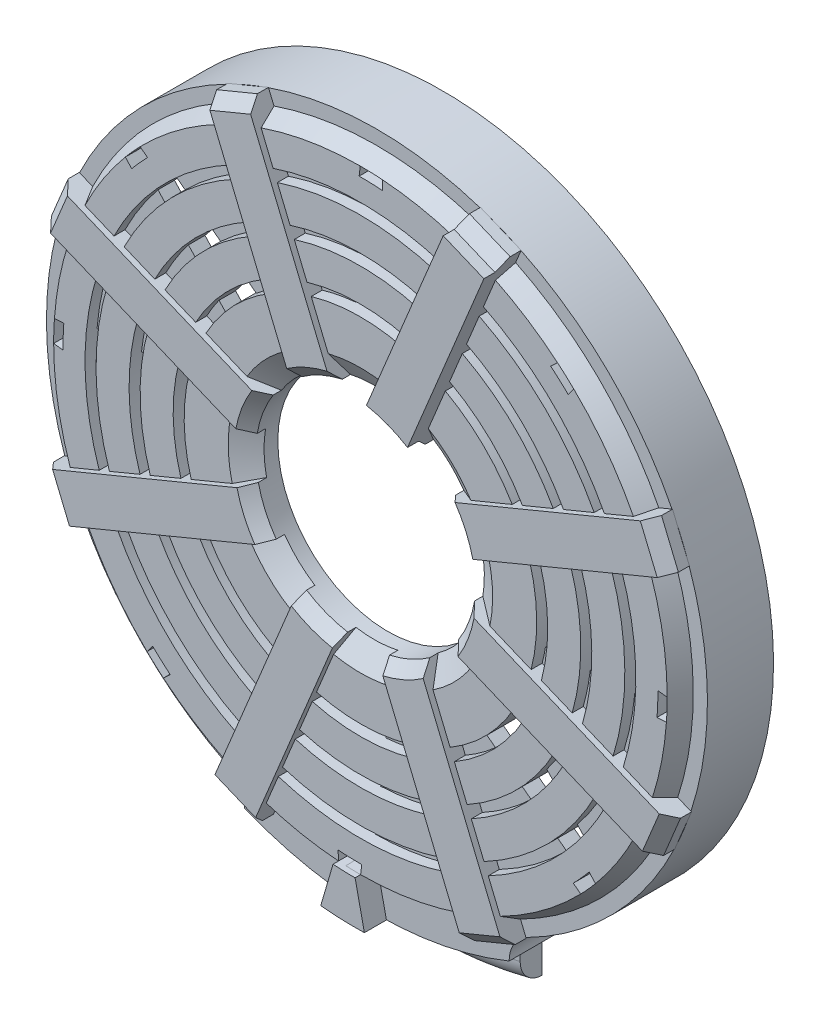
from build123d import *
from build123d.topology import SkipClean

# Parameters (mm, degrees)
SKETCH_2_R           = 26.935647111
EXTRUDE_1_DEPTH      = 2
CUT_EXTRUDE_START    = -2
CUT_EXTRUDE_3_DEPTH  = 2
CUT_EXTRUDE_4_DEPTH  = 2
FILLET_2_R           = 2
EXTRUDE_START        = -2
EXTRUDE_2_DEPTH      = 2
EXTRUDE_3_DEPTH      = 4
SKETCH_9_R           = 30
SKETCH_9_R_2         = 27
EXTRUDE_5_DEPTH      = 4
SKETCH_10_R          = 29
EXTRUDE_6_DEPTH      = 1.5
CHAMFER_1_SIZE       = 2
CHAMFER_1_SIZE_2     = 1.154700538
SKETCH_12_R          = 10
CUT_EXTRUDE_5_DEPTH  = 18
SKETCH_13_R          = 27
EXTRUDE_7_DEPTH      = 6
SKETCH_14_R          = 10
CUT_EXTRUDE_6_DEPTH  = 8
SKETCH_16_R          = 27
CUT_EXTRUDE_7_DEPTH  = 5
CHAMFER_2_SIZE       = 2
CHAMFER_2_SIZE2      = 1.249738704
SKETCH_17_R          = 25
SKETCH_17_R_2        = 24
SKETCH_17_R_3        = 21
SKETCH_17_R_4        = 20
SKETCH_17_R_5        = 17
SKETCH_17_R_6        = 16
CUT_EXTRUDE_10_DEPTH = 1
SKETCH_18_W          = 3
SKETCH_18_H          = 1
CUT_EXTRUDE_11_DEPTH = 71
SKETCH_25_R          = 10.8
SKETCH_25_R_2        = 10.020616019
EXTRUDE_18_DEPTH     = 1
EXTRUDE_19_DEPTH     = 1.5
CHAMFER_3_SIZE       = 2
CHAMFER_4_SIZE       = 2
CUT_EXTRUDE_13_DEPTH = 10
CUT_EXTRUDE_14_DEPTH = 10
EXTRUDE_20_DEPTH     = 3
SKETCH_34_R          = 44.888176971
CUT_EXTRUDE_15_DEPTH = 1
EXTRUDE_21_DEPTH     = 1


# Some blends are built 0.0001 mm under size
with BuildPart() as part:
    # 草图2 → 凸台-拉伸1 (new body)
    with BuildSketch(Plane.XY.offset(20)):
        with BuildLine():
            Line((12, -35.49545417), (12, -29.393876913))
            ThreePointArc((12, -29.393876913), (12.441591404, -27.82717801), (13.636363636, -26.721706285))
            ThreePointArc((13.636363636, -26.721706285), (0, 30), (-13.636363636, -26.721706285))
            ThreePointArc((-13.636363636, -26.721706285), (-12.441591404, -27.82717801), (-12, -29.393876913))
            Line((-12, -29.393876913), (-12, -35.49545417))
            ThreePointArc((-12, -35.49545417), (0, -37.469017424), (12, -35.49545417))
        make_face()
        Circle(SKETCH_2_R, mode=Mode.SUBTRACT)
    extrude(amount=EXTRUDE_1_DEPTH)

    # 草图3 → 切除-拉伸3 (cut)
    with BuildSketch(Plane.XY.offset(22).offset(CUT_EXTRUDE_START)):
        with BuildLine():
            Line((-9, -36.372067122), (-9, -28.618176043))
            ThreePointArc((-9, -28.618176043), (-11.357833819, -27.766879748), (-13.636363636, -26.721706285))
            ThreePointArc((-13.636363636, -26.721706285), (-12.441591404, -27.82717801), (-12, -29.393876913))
            Line((-12, -29.393876913), (-12, -35.49545417))
            ThreePointArc((-12, -35.49545417), (-10.509144236, -35.965054625), (-9, -36.372067122))
        make_face()
        with BuildLine():
            Line((9, -36.372067122), (9, -28.618176043))
            ThreePointArc((9, -28.618176043), (11.357833819, -27.766879748), (13.636363636, -26.721706285))
            ThreePointArc((13.636363636, -26.721706285), (12.441591404, -27.82717801), (12, -29.393876913))
            Line((12, -29.393876913), (12, -35.49545417))
            ThreePointArc((12, -35.49545417), (10.509144236, -35.965054625), (9, -36.372067122))
        make_face()
    extrude(amount=CUT_EXTRUDE_3_DEPTH, mode=Mode.SUBTRACT)

    # 草图4 → 切除-拉伸4 (cut)
    with BuildSketch(Plane.XY.offset(22).offset(CUT_EXTRUDE_START)):
        with BuildLine():
            Line((9, -35), (9, -36.372067122))
            ThreePointArc((9, -36.372067122), (0, -37.469017424), (-9, -36.372067122))
            Line((-9, -36.372067122), (-9, -35))
            ThreePointArc((-9, -35), (0, -36.138621999), (9, -35))
        make_face()
    extrude(amount=CUT_EXTRUDE_4_DEPTH, mode=Mode.SUBTRACT)

    # 圆角2
    fillet_2_edges = [part.edges().sort_by_distance(p)[0] for p in [
        (0, -36.138621999, 22),
    ]]
    fillet(fillet_2_edges, radius=FILLET_2_R - 0.0001)  # a hair under: the kernel refuses the full size

    # 草图7 → 凸台-拉伸2 (add)
    with BuildSketch(Plane.XY.offset(22).offset(EXTRUDE_START)):
        with BuildLine():
            Line((-9, -30.446674695), (-9, -28.618176043))
            ThreePointArc((-9, -28.618176043), (-11.357833819, -27.766879748), (-13.636363636, -26.721706285))
            ThreePointArc((-13.636363636, -26.721706285), (-12.441591404, -27.82717801), (-12, -29.393876913))
            ThreePointArc((-12, -29.393876913), (-10.513186757, -29.957852129), (-9, -30.446674695))
        make_face()
        with BuildLine():
            ThreePointArc((9, -28.618176043), (0, -30), (-9, -28.618176043))
            Line((-9, -28.618176043), (-9, -30.446674695))
            ThreePointArc((-9, -30.446674695), (0, -31.749015733), (9, -30.446674695))
            Line((9, -30.446674695), (9, -28.618176043))
        make_face()
        with BuildLine():
            ThreePointArc((13.636363636, -26.721706285), (11.357833819, -27.766879748), (9, -28.618176043))
            Line((9, -28.618176043), (9, -30.446674695))
            ThreePointArc((9, -30.446674695), (10.513186757, -29.957852129), (12, -29.393876913))
            ThreePointArc((12, -29.393876913), (12.441591404, -27.82717801), (13.636363636, -26.721706285))
        make_face()
    extrude(amount=EXTRUDE_2_DEPTH)

    # 草图8 → 凸台-拉伸3 (add)
    with BuildSketch(Plane.XY.offset(22)):
        with BuildLine():
            ThreePointArc((-12, -29.393876913), (0, -31.749015733), (12, -29.393876913))
            ThreePointArc((12, -29.393876913), (12.441591404, -27.82717801), (13.636363636, -26.721706285))
            ThreePointArc((13.636363636, -26.721706285), (0, -30), (-13.636363636, -26.721706285))
            ThreePointArc((-13.636363636, -26.721706285), (-12.441591404, -27.82717801), (-12, -29.393876913))
        make_face()
    extrude(amount=EXTRUDE_3_DEPTH)

    # 草图9 → 凸台-拉伸5 (add)
    with BuildSketch(Plane.XY.offset(22)):
        Circle(SKETCH_9_R)
        Circle(SKETCH_9_R_2, mode=Mode.SUBTRACT)
    extrude(amount=EXTRUDE_5_DEPTH)

    # 草图10 → 凸台-拉伸6 (add)
    with BuildSketch(Plane.XY.offset(26)):
        with Locations(Location((0, 0, 0), (0, 0, 180))):
            Circle(SKETCH_10_R)
    extrude(amount=EXTRUDE_6_DEPTH)

    # 倒角1
    # the kernel refuses this chamfer: 2, 1.154700538 mm, written as the material it takes off along each edge
    with BuildSketch(Plane(origin=(0, 0, 27.5), x_dir=(-1, 0, 0), z_dir=(0, 1, 0))) as chamfer_1_piece_1_section:
        Polygon((29, -CHAMFER_1_SIZE), (29 - CHAMFER_1_SIZE_2, 0), (29, 0), align=None)
    chamfer_1_piece_1 = revolve(axis=Axis((0, 0, 27.5), (0, 0, 1)), mode=Mode.PRIVATE)
    chamfer_1_piece_1 = split(chamfer_1_piece_1, bisect_by=Plane(origin=(28.310285577, 0, 26), z_dir=(0, 0, 1)), keep=Keep.TOP, mode=Mode.PRIVATE)
    add(chamfer_1_piece_1, mode=Mode.SUBTRACT)

    # 草图12 → 切除-拉伸5 (cut)
    with BuildSketch(Plane.XY.offset(27.5)):
        Circle(SKETCH_12_R)
    extrude(amount=-CUT_EXTRUDE_5_DEPTH, mode=Mode.SUBTRACT)

    # 草图13 → 凸台-拉伸7 (add)
    with BuildSketch(Plane(origin=(0, 0, 20), x_dir=(-1, 0, 0), z_dir=(0, 0, -1))):
        Circle(SKETCH_13_R)
    extrude(amount=-EXTRUDE_7_DEPTH)

    # 草图14 → 切除-拉伸6 (cut)
    with BuildSketch(Plane.XY.offset(27.5)):
        Circle(SKETCH_14_R)
    extrude(amount=-CUT_EXTRUDE_6_DEPTH, mode=Mode.SUBTRACT)

    # 草图16 → 切除-拉伸7 (cut)
    with BuildSketch(Plane(origin=(0, 0, 20), x_dir=(-1, 0, 0), z_dir=(0, 0, -1))):
        Circle(SKETCH_16_R)
    extrude(amount=-CUT_EXTRUDE_7_DEPTH, mode=Mode.SUBTRACT)

    # 倒角2
    chamfer_2_edges = [part.edges().sort_by_distance(p)[0] for p in [
        (-10, 0, 27.5),
    ]]
    chamfer_2_side = [part.faces().sort_by_distance(p)[0] for p in [
        (27.057715459, 0, 27.5),
    ]]
    chamfer(chamfer_2_edges, length=CHAMFER_2_SIZE, length2=CHAMFER_2_SIZE2, reference=chamfer_2_side[0])

    # 草图17 → 切除-拉伸10 (cut)
    # profile 1 of 3: a face of its own
    with BuildSketch(Plane.XY.offset(27.5)):
        Circle(SKETCH_17_R)
        Circle(SKETCH_17_R_2, mode=Mode.SUBTRACT)
    # profile 2 of 3: a face of its own
    with BuildSketch(Plane.XY.offset(27.5)):
        Circle(SKETCH_17_R_3)
        Circle(SKETCH_17_R_4, mode=Mode.SUBTRACT)
    # profile 3 of 3: a face of its own
    with BuildSketch(Plane.XY.offset(27.5)):
        Circle(SKETCH_17_R_5)
        Circle(SKETCH_17_R_6, mode=Mode.SUBTRACT)
    extrude(amount=-CUT_EXTRUDE_10_DEPTH, mode=Mode.SUBTRACT)

    # 草图18 → 切除-拉伸11 (cut)
    with BuildSketch(Plane(origin=(0, 0, 0), x_dir=(1, 0, 0), z_dir=(0, 1, 0))):
        with Locations((-9, -23.265514754)):
            Rectangle(SKETCH_18_W, SKETCH_18_H)
        with Locations((-3, -23.265514754)):
            Rectangle(SKETCH_18_W, SKETCH_18_H)
        with Locations((9, -23.265514754)):
            Rectangle(SKETCH_18_W, SKETCH_18_H)
        with Locations((3, -23.265514754)):
            Rectangle(SKETCH_18_W, SKETCH_18_H)
    extrude(amount=-CUT_EXTRUDE_11_DEPTH, mode=Mode.SUBTRACT)

    # 草图25 → 凸台-拉伸18 (add)
    with BuildSketch(Plane(origin=(0, 0, 25), x_dir=(-1, 0, 0), z_dir=(0, 0, -1))):
        Circle(SKETCH_25_R)
        Circle(SKETCH_25_R_2, mode=Mode.SUBTRACT)
    extrude(amount=-EXTRUDE_18_DEPTH)

    # 草图26 → 凸台-拉伸19 (add, symmetric)
    with SkipClean():  # the faces are left unmerged after this step: merging them gives an invalid solid
        with BuildSketch(Plane.XY.offset(27.5)):
            with BuildLine():
                ThreePointArc((-12.696537001, 24.782224482), (-10.883678655, 25.630182228), (-9.014595586, 26.345735301))
                Line((-9.014595586, 26.345735301), (-9.849943097, 28.362442592))
                Line((-9.849943097, 28.362442592), (-13.545461227, 26.831708862))
                Line((-13.545461227, 26.831708862), (-12.696537001, 24.782224482))
            make_face()
            with BuildLine():
                ThreePointArc((-5.804366846, 8.14305382), (-4.057894195, 9.139666006), (-2.147344545, 9.766724702))
                Line((-2.147344545, 9.766724702), (-7.923333429, 23.711195402))
                ThreePointArc((-7.923333429, 23.711195402), (-9.794923887, 23.001292704), (-11.603720064, 22.143931012))
                Line((-11.603720064, 22.143931012), (-5.804366846, 8.14305382))
            make_face()
            with BuildLine():
                ThreePointArc((-11.603720064, 22.143931012), (-9.794923887, 23.001292704), (-7.923333429, 23.711195402))
                Line((-7.923333429, 23.711195402), (-9.014595586, 26.345735301))
                ThreePointArc((-9.014595586, 26.345735301), (-10.883678655, 25.630182228), (-12.696537001, 24.782224482))
                Line((-12.696537001, 24.782224482), (-11.603720064, 22.143931012))
            make_face()
            with BuildLine():
                ThreePointArc((8.545871573, 26.501486395), (10.427352675, 25.819198638), (12.254966418, 25.003529755))
                Line((12.254966418, 25.003529755), (13.090313929, 27.020237046))
                Line((13.090313929, 27.020237046), (9.394795799, 28.550970775))
                Line((9.394795799, 28.550970775), (8.545871573, 26.501486395))
            make_face()
            with BuildLine():
                ThreePointArc((7.453054636, 23.863192925), (9.338312945, 23.190427149), (11.163704261, 22.368989856))
                Line((11.163704261, 22.368989856), (12.254966418, 25.003529755))
                ThreePointArc((12.254966418, 25.003529755), (10.427352675, 25.819198638), (8.545871573, 26.501486395))
                Line((8.545871573, 26.501486395), (7.453054636, 23.863192925))
            make_face()
            with BuildLine():
                ThreePointArc((1.653701418, 9.862315733), (3.593355308, 9.332084313), (5.387715377, 8.424519156))
                Line((5.387715377, 8.424519156), (11.163704261, 22.368989856))
                ThreePointArc((11.163704261, 22.368989856), (9.338312945, 23.190427149), (7.453054636, 23.863192925))
                Line((7.453054636, 23.863192925), (1.653701418, 9.862315733))
            make_face()
            with BuildLine():
                Line((22.143931012, 11.603720064), (8.14305382, 5.804366846))
                ThreePointArc((8.14305382, 5.804366846), (9.139666006, 4.057894195), (9.766724702, 2.147344545))
                Line((9.766724702, 2.147344545), (23.711195402, 7.923333429))
                ThreePointArc((23.711195402, 7.923333429), (23.001292704, 9.794923887), (22.143931012, 11.603720064))
            make_face()
            with BuildLine():
                Line((24.782224482, 12.696537001), (22.143931012, 11.603720064))
                ThreePointArc((22.143931012, 11.603720064), (23.001292704, 9.794923887), (23.711195402, 7.923333429))
                Line((23.711195402, 7.923333429), (26.345735301, 9.014595586))
                ThreePointArc((26.345735301, 9.014595586), (25.630182228, 10.883678655), (24.782224482, 12.696537001))
            make_face()
            with BuildLine():
                Line((26.831708862, 13.545461227), (24.782224482, 12.696537001))
                ThreePointArc((24.782224482, 12.696537001), (25.630182228, 10.883678655), (26.345735301, 9.014595586))
                Line((26.345735301, 9.014595586), (28.362442592, 9.849943097))
                Line((28.362442592, 9.849943097), (26.831708862, 13.545461227))
            make_face()
            with BuildLine():
                Line((26.501486395, -8.545871573), (23.863192925, -7.453054636))
                ThreePointArc((23.863192925, -7.453054636), (23.190427149, -9.338312945), (22.368989856, -11.163704261))
                Line((22.368989856, -11.163704261), (25.003529755, -12.254966418))
                ThreePointArc((25.003529755, -12.254966418), (25.819198638, -10.427352675), (26.501486395, -8.545871573))
            make_face()
            with BuildLine():
                Line((28.550970775, -9.394795799), (26.501486395, -8.545871573))
                ThreePointArc((26.501486395, -8.545871573), (25.819198638, -10.427352675), (25.003529755, -12.254966418))
                Line((25.003529755, -12.254966418), (27.020237046, -13.090313929))
                Line((27.020237046, -13.090313929), (28.550970775, -9.394795799))
            make_face()
            with BuildLine():
                Line((23.863192925, -7.453054636), (9.862315733, -1.653701418))
                ThreePointArc((9.862315733, -1.653701418), (9.332084313, -3.593355308), (8.424519156, -5.387715377))
                Line((8.424519156, -5.387715377), (22.368989856, -11.163704261))
                ThreePointArc((22.368989856, -11.163704261), (23.190427149, -9.338312945), (23.863192925, -7.453054636))
            make_face()
            with BuildLine():
                Line((11.603720064, -22.143931012), (5.804366846, -8.14305382))
                ThreePointArc((5.804366846, -8.14305382), (4.057894195, -9.139666006), (2.147344545, -9.766724702))
                Line((2.147344545, -9.766724702), (7.923333429, -23.711195402))
                ThreePointArc((7.923333429, -23.711195402), (9.794923887, -23.001292704), (11.603720064, -22.143931012))
            make_face()
            with BuildLine():
                Line((12.696537001, -24.782224482), (11.603720064, -22.143931012))
                ThreePointArc((11.603720064, -22.143931012), (9.794923887, -23.001292704), (7.923333429, -23.711195402))
                Line((7.923333429, -23.711195402), (9.014595586, -26.345735301))
                ThreePointArc((9.014595586, -26.345735301), (10.883678655, -25.630182228), (12.696537001, -24.782224482))
            make_face()
            with BuildLine():
                Line((13.545461227, -26.831708862), (12.696537001, -24.782224482))
                ThreePointArc((12.696537001, -24.782224482), (10.883678655, -25.630182228), (9.014595586, -26.345735301))
                Line((9.014595586, -26.345735301), (9.849943097, -28.362442592))
                Line((9.849943097, -28.362442592), (13.545461227, -26.831708862))
            make_face()
            with BuildLine():
                Line((-9.394795799, -28.550970775), (-8.545871573, -26.501486395))
                ThreePointArc((-8.545871573, -26.501486395), (-10.427352675, -25.819198638), (-12.254966418, -25.003529755))
                Line((-12.254966418, -25.003529755), (-13.090313929, -27.020237046))
                Line((-13.090313929, -27.020237046), (-9.394795799, -28.550970775))
            make_face()
            with BuildLine():
                Line((-7.453054636, -23.863192925), (-1.653701418, -9.862315733))
                ThreePointArc((-1.653701418, -9.862315733), (-3.593355308, -9.332084313), (-5.387715377, -8.424519156))
                Line((-5.387715377, -8.424519156), (-11.163704261, -22.368989856))
                ThreePointArc((-11.163704261, -22.368989856), (-9.338312945, -23.190427149), (-7.453054636, -23.863192925))
            make_face()
            with BuildLine():
                Line((-8.545871573, -26.501486395), (-7.453054636, -23.863192925))
                ThreePointArc((-7.453054636, -23.863192925), (-9.338312945, -23.190427149), (-11.163704261, -22.368989856))
                Line((-11.163704261, -22.368989856), (-12.254966418, -25.003529755))
                ThreePointArc((-12.254966418, -25.003529755), (-10.427352675, -25.819198638), (-8.545871573, -26.501486395))
            make_face()
            with BuildLine():
                ThreePointArc((-8.14305382, -5.804366846), (-9.139666006, -4.057894195), (-9.766724702, -2.147344545))
                Line((-9.766724702, -2.147344545), (-23.711195402, -7.923333429))
                ThreePointArc((-23.711195402, -7.923333429), (-23.001292704, -9.794923887), (-22.143931012, -11.603720064))
                Line((-22.143931012, -11.603720064), (-8.14305382, -5.804366846))
            make_face()
            with BuildLine():
                ThreePointArc((-22.143931012, -11.603720064), (-23.001292704, -9.794923887), (-23.711195402, -7.923333429))
                Line((-23.711195402, -7.923333429), (-26.345735301, -9.014595586))
                ThreePointArc((-26.345735301, -9.014595586), (-25.630182228, -10.883678655), (-24.782224482, -12.696537001))
                Line((-24.782224482, -12.696537001), (-22.143931012, -11.603720064))
            make_face()
            with BuildLine():
                ThreePointArc((-24.782224482, -12.696537001), (-25.630182228, -10.883678655), (-26.345735301, -9.014595586))
                Line((-26.345735301, -9.014595586), (-28.362442592, -9.849943097))
                Line((-28.362442592, -9.849943097), (-26.831708862, -13.545461227))
                Line((-26.831708862, -13.545461227), (-24.782224482, -12.696537001))
            make_face()
            with BuildLine():
                ThreePointArc((-9.862315733, 1.653701418), (-9.332084313, 3.593355308), (-8.424519156, 5.387715377))
                Line((-8.424519156, 5.387715377), (-22.368989856, 11.163704261))
                ThreePointArc((-22.368989856, 11.163704261), (-23.190427149, 9.338312945), (-23.863192925, 7.453054636))
                Line((-23.863192925, 7.453054636), (-9.862315733, 1.653701418))
            make_face()
            with BuildLine():
                ThreePointArc((-23.863192925, 7.453054636), (-23.190427149, 9.338312945), (-22.368989856, 11.163704261))
                Line((-22.368989856, 11.163704261), (-25.003529755, 12.254966418))
                ThreePointArc((-25.003529755, 12.254966418), (-25.819198638, 10.427352675), (-26.501486395, 8.545871573))
                Line((-26.501486395, 8.545871573), (-23.863192925, 7.453054636))
            make_face()
            with BuildLine():
                ThreePointArc((-26.501486395, 8.545871573), (-25.819198638, 10.427352675), (-25.003529755, 12.254966418))
                Line((-25.003529755, 12.254966418), (-27.020237046, 13.090313929))
                Line((-27.020237046, 13.090313929), (-28.550970775, 9.394795799))
                Line((-28.550970775, 9.394795799), (-26.501486395, 8.545871573))
            make_face()
        extrude(amount=EXTRUDE_19_DEPTH, both=True)

    # 倒角3
    chamfer_3_edges = [part.edges().sort_by_distance(p)[0] for p in [
        (-4.057894195, 9.139666006, 29),
        (3.593355308, 9.332084313, 29),
        (9.139666006, 4.057894195, 29),
        (9.332084313, -3.593355308, 29),
        (4.057894195, -9.139666006, 29),
        (-3.593355308, -9.332084313, 29),
        (-9.139666006, -4.057894195, 29),
        (-9.332084313, 3.593355308, 29),
    ]]
    chamfer(chamfer_3_edges, length=CHAMFER_3_SIZE)

    # 倒角4
    chamfer_4_edges = [part.edges().sort_by_distance(p)[0] for p in [
        (-11.697702162, 27.597075727, 29),
        (11.242554864, 27.785603911, 29),
        (27.597075727, 11.697702162, 29),
        (27.785603911, -11.242554864, 29),
        (11.697702162, -27.597075727, 29),
        (-11.242554864, -27.785603911, 29),
        (-27.597075727, -11.697702162, 29),
        (-27.785603911, 11.242554864, 29),
    ]]
    chamfer(chamfer_4_edges, length=CHAMFER_4_SIZE)

    # 草图30 → 切除-拉伸13 (cut)
    with BuildSketch(Plane.XY.offset(27.5)):
        with BuildLine():
            Line((-2.126135419, -24.909426894), (-2.175382477, -23.901207314))
            ThreePointArc((-2.175382477, -23.901207314), (-0.849786937, -23.984950743), (0.478411395, -23.995231246))
            Line((0.478411395, -23.995231246), (0.357934938, -24.99743752))
            ThreePointArc((0.357934938, -24.99743752), (-0.885194726, -24.984323691), (-2.126135419, -24.909426894))
        make_face()
        with BuildLine():
            Line((-12.843867709, -16.614302943), (-12.104365365, -15.92119151))
            ThreePointArc((-12.104365365, -15.92119151), (-13.390169765, -14.856088101), (-14.582653444, -13.68744748))
            Line((-14.582653444, -13.68744748), (-15.195490387, -14.494725658))
            ThreePointArc((-15.195490387, -14.494725658), (-14.059678253, -15.598892506), (-12.843867709, -16.614302943))
        make_face()
        with BuildLine():
            Line((2.126135419, 24.909426894), (2.175382477, 23.901207314))
            ThreePointArc((2.175382477, 23.901207314), (0.849786937, 23.984950743), (-0.478411395, 23.995231246))
            Line((-0.478411395, 23.995231246), (-0.357934938, 24.99743752))
            ThreePointArc((-0.357934938, 24.99743752), (0.885194726, 24.984323691), (2.126135419, 24.909426894))
        make_face()
        with BuildLine():
            Line((-2.56527052, -15.919151584), (-2.571480969, -15.792007017))
            ThreePointArc((-2.571480969, -15.792007017), (-0.566524625, -15.989967162), (1.447414317, -15.934396499))
            Line((1.447414317, -15.934396499), (1.432221271, -16.06078274))
            Line((1.432221271, -16.06078274), (1.32553855, -16.9482432))
            ThreePointArc((1.32553855, -16.9482432), (-0.601932414, -16.98934011), (-2.521661916, -16.811936866))
            Line((-2.521661916, -16.811936866), (-2.56527052, -15.919151584))
        make_face()
        with BuildLine():
            Line((-1.986195559, -27.774371808), (-2.027744721, -26.923748835))
            ThreePointArc((-2.027744721, -26.923748835), (-0.956010304, -26.983069586), (0.11723502, -26.999745479))
            Line((0.11723502, -26.999745479), (0.015590454, -27.845295097))
            ThreePointArc((0.015590454, -27.845295097), (-0.985940489, -27.827839001), (-1.986195559, -27.774371808))
        make_face()
        with BuildLine():
            Line((-12.738209811, -11.257797779), (-12.197744622, -10.545853504))
            Line((-12.197744622, -10.545853504), (-12.120775149, -10.444463116))
            ThreePointArc((-12.120775149, -10.444463116), (-10.712135812, -11.884870481), (-9.133648943, -13.136835882))
            Line((-9.133648943, -13.136835882), (-9.226527002, -13.223887457))
            Line((-9.226527002, -13.223887457), (-9.878699294, -13.83514728))
            ThreePointArc((-9.878699294, -13.83514728), (-11.3816443, -12.627674886), (-12.738209811, -11.257797779))
        make_face()
        with BuildLine():
            Line((0.840494588, -20.983173469), (0.961462809, -19.976876364))
            ThreePointArc((0.961462809, -19.976876364), (-0.708155781, -19.987458953), (-2.372838988, -19.858742033))
            Line((-2.372838988, -19.858742033), (-2.323390913, -20.871076989))
            ThreePointArc((-2.323390913, -20.871076989), (-0.74356357, -20.9868319), (0.840494588, -20.983173469))
        make_face()
        with BuildLine():
            Line((-19.374536136, -19.999701289), (-18.859594733, -19.321379001))
            ThreePointArc((-18.859594733, -19.321379001), (-18.076729183, -20.055718937), (-17.265294623, -20.758362208))
            Line((-17.265294623, -20.758362208), (-17.886667696, -21.340754927))
            ThreePointArc((-17.886667696, -21.340754927), (-18.642664347, -20.6836111), (-19.374536136, -19.999701289))
        make_face()
        with BuildLine():
            Line((-17.640185195, -17.715074549), (-17.029839576, -16.911078144))
            ThreePointArc((-17.029839576, -16.911078144), (-16.068203718, -17.827305721), (-15.057352946, -18.688930474))
            Line((-15.057352946, -18.688930474), (-15.793849042, -19.379224248))
            ThreePointArc((-15.793849042, -19.379224248), (-16.737712206, -18.570110126), (-17.640185195, -17.715074549))
        make_face()
        with BuildLine():
            Line((2.56527052, 15.919151584), (2.571480969, 15.792007017))
            ThreePointArc((2.571480969, 15.792007017), (0.566524625, 15.989967162), (-1.447414317, 15.934396499))
            Line((-1.447414317, 15.934396499), (-1.432221271, 16.06078274))
            Line((-1.432221271, 16.06078274), (-1.32553855, 16.9482432))
            ThreePointArc((-1.32553855, 16.9482432), (0.601932414, 16.98934011), (2.521661916, 16.811936866))
            Line((2.521661916, 16.811936866), (2.56527052, 15.919151584))
        make_face()
        with BuildLine():
            Line((1.986195559, 27.774371808), (2.027744721, 26.923748835))
            ThreePointArc((2.027744721, 26.923748835), (0.956010304, 26.983069586), (-0.11723502, 26.999745479))
            Line((-0.11723502, 26.999745479), (-0.015590454, 27.845295097))
            ThreePointArc((-0.015590454, 27.845295097), (0.985940489, 27.827839001), (1.986195559, 27.774371808))
        make_face()
        with BuildLine():
            Line((12.843867709, 16.614302943), (12.104365365, 15.92119151))
            ThreePointArc((12.104365365, 15.92119151), (13.390169765, 14.856088101), (14.582653444, 13.68744748))
            Line((14.582653444, 13.68744748), (15.195490387, 14.494725658))
            ThreePointArc((15.195490387, 14.494725658), (14.059678253, 15.598892506), (12.843867709, 16.614302943))
        make_face()
        with BuildLine():
            Line((12.738209811, 11.257797779), (12.197744622, 10.545853504))
            Line((12.197744622, 10.545853504), (12.120775149, 10.444463116))
            ThreePointArc((12.120775149, 10.444463116), (10.712135812, 11.884870481), (9.133648943, 13.136835882))
            Line((9.133648943, 13.136835882), (9.226527002, 13.223887457))
            Line((9.226527002, 13.223887457), (9.878699294, 13.83514728))
            ThreePointArc((9.878699294, 13.83514728), (11.3816443, 12.627674886), (12.738209811, 11.257797779))
        make_face()
        with BuildLine():
            Line((19.374536136, 19.999701289), (18.859594733, 19.321379001))
            ThreePointArc((18.859594733, 19.321379001), (18.076729183, 20.055718937), (17.265294623, 20.758362208))
            Line((17.265294623, 20.758362208), (17.886667696, 21.340754927))
            ThreePointArc((17.886667696, 21.340754927), (18.642664347, 20.6836111), (19.374536136, 19.999701289))
        make_face()
        with BuildLine():
            Line((-0.840494588, 20.983173469), (-0.961462809, 19.976876364))
            ThreePointArc((-0.961462809, 19.976876364), (0.708155781, 19.987458953), (2.372838988, 19.858742033))
            Line((2.372838988, 19.858742033), (2.323390913, 20.871076989))
            ThreePointArc((2.323390913, 20.871076989), (0.74356357, 20.9868319), (-0.840494588, 20.983173469))
        make_face()
        with BuildLine():
            Line((17.640185195, 17.715074549), (17.029839576, 16.911078144))
            ThreePointArc((17.029839576, 16.911078144), (16.068203718, 17.827305721), (15.057352946, 18.688930474))
            Line((15.057352946, 18.688930474), (15.793849042, 19.379224248))
            ThreePointArc((15.793849042, 19.379224248), (16.737712206, 18.570110126), (17.640185195, 17.715074549))
        make_face()
    extrude(amount=-CUT_EXTRUDE_13_DEPTH, mode=Mode.SUBTRACT)

    # 草图31 → 切除-拉伸14 (cut)
    with BuildSketch(Plane.XY.offset(27.5)):
        with BuildLine():
            Line((19.32146818, -18.85950337), (19.999703135, -19.37453423))
            ThreePointArc((19.999703135, -19.37453423), (20.6836111, -18.642664347), (21.340753222, -17.886669729))
            Line((21.340753222, -17.886669729), (20.758280568, -17.265392781))
            ThreePointArc((20.758280568, -17.265392781), (20.055718937, -18.076729183), (19.32146818, -18.85950337))
        make_face()
        with BuildLine():
            Line((15.898543824, -2.564540387), (16.812179047, -2.520046764))
            ThreePointArc((16.812179047, -2.520046764), (16.98934011, -0.601932414), (16.948370467, 1.323910308))
            Line((16.948370467, 1.323910308), (16.04017498, 1.432951404))
            Line((16.04017498, 1.432951404), (15.934558287, 1.445632109))
            ThreePointArc((15.934558287, 1.445632109), (15.989967162, -0.566524625), (15.792294528, -2.56971468))
            Line((15.792294528, -2.56971468), (15.898543824, -2.564540387))
        make_face()
        with BuildLine():
            Line((19.858881229, -2.371673742), (20.871190083, -2.322374758))
            ThreePointArc((20.871190083, -2.322374758), (20.9868319, -0.74356357), (20.983214366, 0.839472977))
            Line((20.983214366, 0.839472977), (19.976932745, 0.960290633))
            ThreePointArc((19.976932745, 0.960290633), (19.987458953, -0.708155781), (19.858881229, -2.371673742))
        make_face()
        with BuildLine():
            Line((23.995242663, 0.477838429), (24.997443591, 0.357510715))
            ThreePointArc((24.997443591, 0.357510715), (24.984323691, -0.885194726), (24.909462972, -2.12571269))
            Line((24.909462972, -2.12571269), (23.901259252, -2.174811756))
            ThreePointArc((23.901259252, -2.174811756), (23.984950743, -0.849786937), (23.995242663, 0.477838429))
        make_face()
        with BuildLine():
            Line((18.688570924, -15.057799202), (19.378956213, -15.794177918))
            ThreePointArc((19.378956213, -15.794177918), (18.570110126, -16.737712206), (17.715373912, -17.639884556))
            Line((17.715373912, -17.639884556), (16.911484783, -17.029435764))
            ThreePointArc((16.911484783, -17.029435764), (17.827305721, -16.068203718), (18.688570924, -15.057799202))
        make_face()
        with BuildLine():
            Line((26.923758423, -2.02761741), (27.774371997, -1.986192913))
            ThreePointArc((27.774371997, -1.986192913), (27.827839001, -0.985940489), (27.845295099, 0.015587801))
            Line((27.845295099, 0.015587801), (26.999746033, 0.117107349))
            ThreePointArc((26.999746033, 0.117107349), (26.983069586, -0.956010304), (26.923758423, -2.02761741))
        make_face()
        with BuildLine():
            Line((13.688303116, -14.581850287), (14.495465465, -15.194784663))
            ThreePointArc((14.495465465, -15.194784663), (15.598892506, -14.059678253), (16.613677592, -12.844676597))
            Line((16.613677592, -12.844676597), (15.920481241, -12.105299545))
            ThreePointArc((15.920481241, -12.105299545), (14.856088101, -13.390169765), (13.688303116, -14.581850287))
        make_face()
        with BuildLine():
            Line((10.530536365, -12.183938895), (10.445818711, -12.119606902))
            ThreePointArc((10.445818711, -12.119606902), (11.884870481, -10.712135812), (13.135814238, -9.135118188))
            Line((13.135814238, -9.135118188), (13.208570318, -9.212721274))
            Line((13.208570318, -9.212721274), (13.834198159, -9.880028406))
            ThreePointArc((13.834198159, -9.880028406), (12.627674886, -11.3816443), (11.2590215, -12.737128203))
            Line((11.2590215, -12.737128203), (10.530536365, -12.183938895))
        make_face()
        with BuildLine():
            Line((-15.898543824, 2.564540387), (-16.812179047, 2.520046764))
            ThreePointArc((-16.812179047, 2.520046764), (-16.98934011, 0.601932414), (-16.948370467, -1.323910308))
            Line((-16.948370467, -1.323910308), (-16.04017498, -1.432951404))
            Line((-16.04017498, -1.432951404), (-15.934558287, -1.445632109))
            ThreePointArc((-15.934558287, -1.445632109), (-15.989967162, 0.566524625), (-15.792294528, 2.56971468))
            Line((-15.792294528, 2.56971468), (-15.898543824, 2.564540387))
        make_face()
        with BuildLine():
            Line((-19.858881229, 2.371673742), (-20.871190083, 2.322374758))
            ThreePointArc((-20.871190083, 2.322374758), (-20.9868319, 0.74356357), (-20.983214366, -0.839472977))
            Line((-20.983214366, -0.839472977), (-19.976932745, -0.960290633))
            ThreePointArc((-19.976932745, -0.960290633), (-19.987458953, 0.708155781), (-19.858881229, 2.371673742))
        make_face()
        with BuildLine():
            Line((-23.995242663, -0.477838429), (-24.997443591, -0.357510715))
            ThreePointArc((-24.997443591, -0.357510715), (-24.984323691, 0.885194726), (-24.909462972, 2.12571269))
            Line((-24.909462972, 2.12571269), (-23.901259252, 2.174811756))
            ThreePointArc((-23.901259252, 2.174811756), (-23.984950743, 0.849786937), (-23.995242663, -0.477838429))
        make_face()
        with BuildLine():
            Line((-26.923758423, 2.02761741), (-27.774371997, 1.986192913))
            ThreePointArc((-27.774371997, 1.986192913), (-27.827839001, 0.985940489), (-27.845295099, -0.015587801))
            Line((-27.845295099, -0.015587801), (-26.999746033, -0.117107349))
            ThreePointArc((-26.999746033, -0.117107349), (-26.983069586, 0.956010304), (-26.923758423, 2.02761741))
        make_face()
        with BuildLine():
            Line((-19.32146818, 18.85950337), (-19.999703135, 19.37453423))
            ThreePointArc((-19.999703135, 19.37453423), (-20.6836111, 18.642664347), (-21.340753222, 17.886669729))
            Line((-21.340753222, 17.886669729), (-20.758280568, 17.265392781))
            ThreePointArc((-20.758280568, 17.265392781), (-20.055718937, 18.076729183), (-19.32146818, 18.85950337))
        make_face()
        with BuildLine():
            Line((-18.688570924, 15.057799202), (-19.378956213, 15.794177918))
            ThreePointArc((-19.378956213, 15.794177918), (-18.570110126, 16.737712206), (-17.715373912, 17.639884556))
            Line((-17.715373912, 17.639884556), (-16.911484783, 17.029435764))
            ThreePointArc((-16.911484783, 17.029435764), (-17.827305721, 16.068203718), (-18.688570924, 15.057799202))
        make_face()
        with BuildLine():
            Line((-13.688303116, 14.581850287), (-14.495465465, 15.194784663))
            ThreePointArc((-14.495465465, 15.194784663), (-15.598892506, 14.059678253), (-16.613677592, 12.844676597))
            Line((-16.613677592, 12.844676597), (-15.920481241, 12.105299545))
            ThreePointArc((-15.920481241, 12.105299545), (-14.856088101, 13.390169765), (-13.688303116, 14.581850287))
        make_face()
        with BuildLine():
            Line((-10.530536365, 12.183938895), (-10.445818711, 12.119606902))
            ThreePointArc((-10.445818711, 12.119606902), (-11.884870481, 10.712135812), (-13.135814238, 9.135118188))
            Line((-13.135814238, 9.135118188), (-13.208570318, 9.212721274))
            Line((-13.208570318, 9.212721274), (-13.834198159, 9.880028406))
            ThreePointArc((-13.834198159, 9.880028406), (-12.627674886, 11.3816443), (-11.2590215, 12.737128203))
            Line((-11.2590215, 12.737128203), (-10.530536365, 12.183938895))
        make_face()
    extrude(amount=-CUT_EXTRUDE_14_DEPTH, mode=Mode.SUBTRACT)


with BuildPart() as body_2:
    # 草图32 → 凸台-拉伸20 (new body)
    with BuildSketch(Plane.XY.offset(26)):
        with BuildLine():
            Line((-1.986195559, -27.774371808), (-3.104919331, -31.596826992))
            ThreePointArc((-3.104919331, -31.596826992), (-1.124162452, -31.729107438), (0.860989474, -31.737339163))
            Line((0.860989474, -31.737339163), (0.015590454, -27.845295097))
            ThreePointArc((0.015590454, -27.845295097), (-0.985940489, -27.827839001), (-1.986195559, -27.774371808))
        make_face()
    extrude(amount=EXTRUDE_20_DEPTH)


with BuildPart() as cut_extrude_15_tool:
    # 草图34 → 切除-拉伸15 (new body)
    with BuildSketch(Plane.XY.offset(29)):
        Circle(SKETCH_34_R)
    extrude(amount=-CUT_EXTRUDE_15_DEPTH)


with BuildPart() as part_1:
    add(part.part)

    # 切除-拉伸15: cut by cut_extrude_15_tool
    add(cut_extrude_15_tool.part, mode=Mode.SUBTRACT)

    # 草图35 → 凸台-拉伸21 (add)
    with BuildSketch(Plane.XY.offset(28)):
        with BuildLine():
            Line((5.775863556, 9.361591754), (12.707630497, 26.096357513))
            Line((12.707630497, 26.096357513), (9.012112367, 27.627091243))
            Line((9.012112367, 27.627091243), (2.045477201, 10.808146142))
            ThreePointArc((2.045477201, 10.808146142), (3.976992923, 10.255902071), (5.775863556, 9.361591754))
        make_face()
    extrude(amount=EXTRUDE_21_DEPTH)


with BuildPart() as body_2_1:
    add(body_2.part)

    # 切除-拉伸15: cut by cut_extrude_15_tool
    add(cut_extrude_15_tool.part, mode=Mode.SUBTRACT)


solid = Compound([part_1.part, body_2_1.part])
